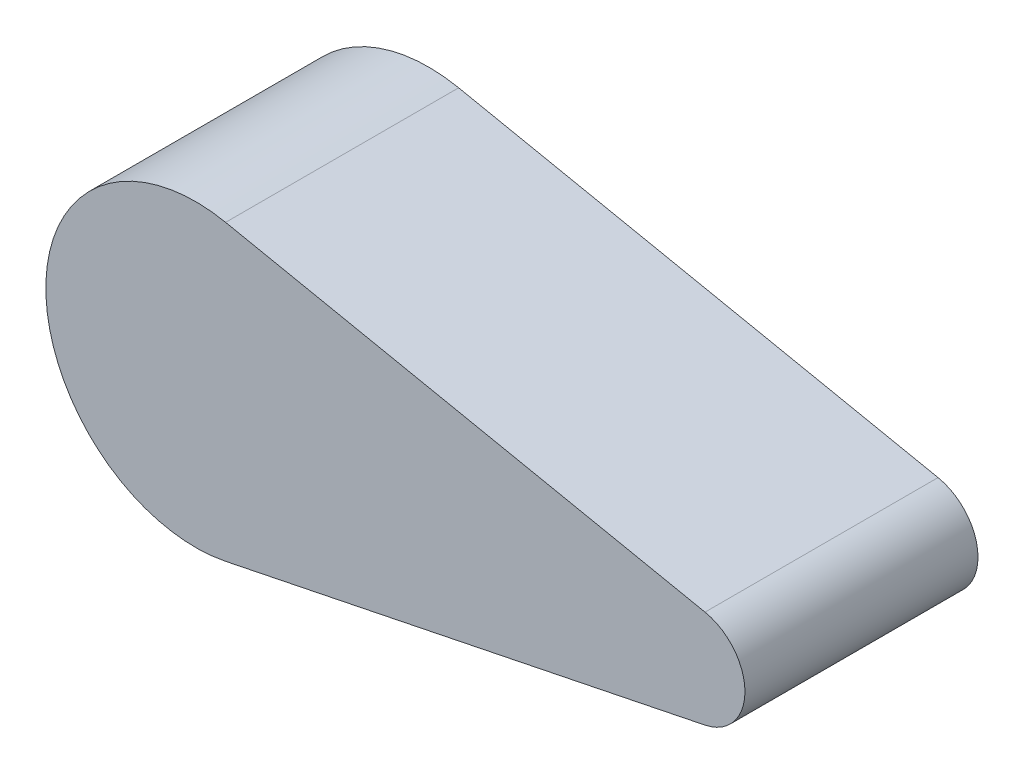
from build123d import *

# Parameters (mm, degrees)
BOSS_EXTRUDE1_DEPTH = 7


with BuildPart() as part:
    # Sketch1 → Boss-Extrude1 (new body)
    with BuildSketch(Plane.XY):
        with BuildLine():
            Line((0.9, 4.409081537), (15.3, 1.469693846))
            ThreePointArc((15.3, 1.469693846), (16.5, 0), (15.3, -1.469693846))
            Line((15.3, -1.469693846), (0.9, -4.409081537))
            ThreePointArc((0.9, -4.409081537), (-4.5, 0), (0.9, 4.409081537))
        make_face()
    extrude(amount=BOSS_EXTRUDE1_DEPTH)


solid = part.part
